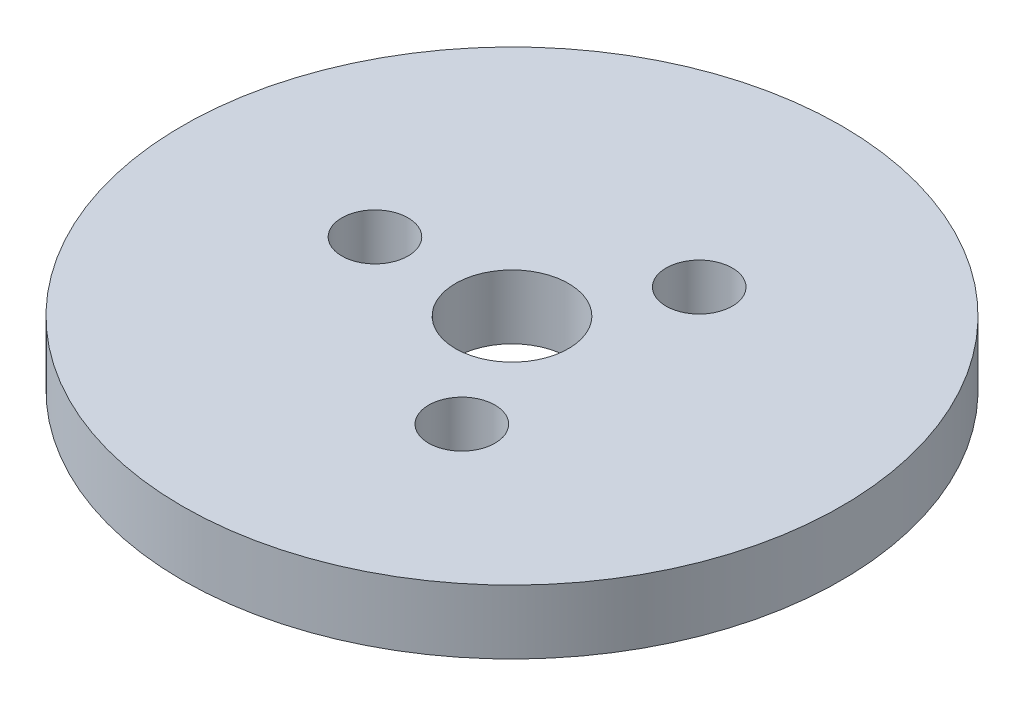
from build123d import *

# Parameters (mm, degrees)
SKETCH1_R           = 87.5
BOSS_EXTRUDE1_DEPTH = 17
SKETCH2_R           = 15
CUT_EXTRUDE1_DEPTH  = 125.905964629
SKETCH3_R           = 8.791489872
CUT_EXTRUDE2_DEPTH  = 14.763526788
CIRPATTERN1_COUNT   = 3


with BuildPart() as part:
    # Sketch1 → Boss-Extrude1 (new body)
    with BuildSketch(Plane(origin=(0, 0, 0), x_dir=(1, 0, 0), z_dir=(0, 1, 0))):
        Circle(SKETCH1_R)
    extrude(amount=BOSS_EXTRUDE1_DEPTH)

    # Sketch2 → Cut-Extrude1 (cut, through all)
    with BuildSketch(Plane(origin=(0, 0, 0), x_dir=(1, 0, 0), z_dir=(0, 1, 0))):
        Circle(SKETCH2_R)
    extrude(amount=CUT_EXTRUDE1_DEPTH, mode=Mode.SUBTRACT)

    # Sketch3 → Cut-Extrude2 (cut)
    with BuildSketch(Plane(origin=(0, 17, 0), x_dir=(1, 0, 0), z_dir=(0, 1, 0))):
        with Locations((-36.387581524, 0)):
            Circle(SKETCH3_R)
    cut_extrude2 = extrude(amount=-CUT_EXTRUDE2_DEPTH, mode=Mode.SUBTRACT)

    # CirPattern1: Cut-Extrude2 ×3 about axis
    cirpattern1_axis = Axis((0, 0, 0), (0, 1, 0))
    for i in range(1, CIRPATTERN1_COUNT):
        add(cut_extrude2.rotate(cirpattern1_axis, i * 360 / CIRPATTERN1_COUNT), mode=Mode.SUBTRACT)


solid = part.part
